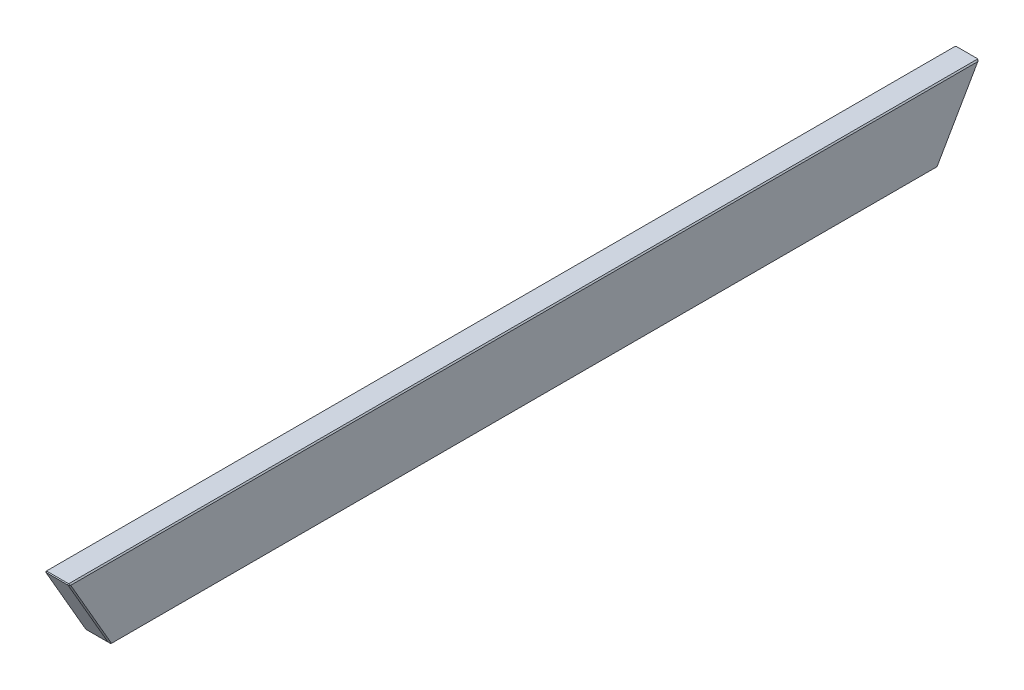
from build123d import *
from OCP.BRepFilletAPI import BRepFilletAPI_MakeChamfer

# Parameters (mm, degrees)
SKETCH1_W           = 2.1
SKETCH1_H           = 6.25
BOSS_EXTRUDE1_DEPTH = 39
DRAFT1_ANGLE        = -30
DRAFT2_ANGLE        = -30
CHAMFER1_SIZE       = 0.1
CHAMFER2_SIZE       = 0.273205081
CHAMFER2_SIZE_2     = 0.1
CHAMFER2_SIZE_3     = 0.073205081
CHAMFER2_SIZE_4     = 0.077581461
CHAMFER2_SIZE_5     = 0.171862365


with BuildPart() as part:
    # Sketch1 → Boss-Extrude1 (new, symmetric)
    with BuildSketch(Plane.XY):
        Rectangle(SKETCH1_W, SKETCH1_H)
    extrude(amount=BOSS_EXTRUDE1_DEPTH, both=True)

    # Draft1
    draft1_faces = [part.faces().sort_by_distance(p)[0] for p in [
        (0, 0, 39),
    ]]
    draft(draft1_faces, Plane(origin=(-1.05, 3.125, 39), x_dir=(0, 0, 1), z_dir=(0, 1, 0)), DRAFT1_ANGLE)

    # Draft2
    draft2_faces = [part.faces().sort_by_distance(p)[0] for p in [
        (0, 0, -39),
    ]]
    draft(draft2_faces, Plane(origin=(-1.05, 3.125, 39), x_dir=(0, 0, 1), z_dir=(0, 1, 0)), DRAFT2_ANGLE)

    # Chamfer1
    chamfer1_edges = [part.edges().sort_by_distance(p)[0] for p in [
        (1.05, -3.125, 0),
        (-1.05, -3.125, 0),
        (-1.05, 3.125, 0),
        (1.05, 3.125, 0),
    ]]
    chamfer(chamfer1_edges, length=CHAMFER1_SIZE)

    # Chamfer2
    chamfer2_edges_1 = [part.edges().sort_by_distance(p)[0] for p in [
        (0, -3.125, -35.391560818),
    ]]
    chamfer2_side_1 = [part.faces().sort_by_distance(p)[0] for p in [
        (0, -3.125, -35.389560818),
    ]]
    chamfer2_edges_2 = [part.edges().sort_by_distance(p)[0] for p in [
        (0, -3.125, 35.391560818),
    ]]
    chamfer2_side_2 = [part.faces().sort_by_distance(p)[0] for p in [
        (0, -3.125, 35.389560818),
    ]]
    chamfer2_edges_3 = [part.edges().sort_by_distance(p)[0] for p in [
        (0, 3.125, -39),
    ]]
    chamfer2_side_3 = [part.faces().sort_by_distance(p)[0] for p in [
        (0, 3.123732051, -38.999267949),
    ]]
    chamfer2_edges_4 = [part.edges().sort_by_distance(p)[0] for p in [
        (1, 3.075, -38.971132487),
    ]]
    chamfer2_side_4 = [part.faces().sort_by_distance(p)[0] for p in [
        (0.998827079, 3.074120309, -38.970624597),
    ]]
    chamfer2_edges_5 = [part.edges().sort_by_distance(p)[0] for p in [
        (1, 3.075, 38.971132487),
    ]]
    chamfer2_side_5 = [part.faces().sort_by_distance(p)[0] for p in [
        (0.998827079, 3.074120309, 38.970624597),
    ]]
    chamfer2_edges_6 = [part.edges().sort_by_distance(p)[0] for p in [
        (-1, 3.075, -38.971132487),
    ]]
    chamfer2_side_6 = [part.faces().sort_by_distance(p)[0] for p in [
        (-0.998827079, 3.074120309, -38.970624597),
    ]]
    chamfer2_edges_7 = [part.edges().sort_by_distance(p)[0] for p in [
        (-1, 3.075, 38.971132487),
    ]]
    chamfer2_side_7 = [part.faces().sort_by_distance(p)[0] for p in [
        (-0.998827079, 3.074120309, 38.970624597),
    ]]
    chamfer2_edges_8 = [part.edges().sort_by_distance(p)[0] for p in [
        (0, 3.125, 39),
    ]]
    chamfer2_side_8 = [part.faces().sort_by_distance(p)[0] for p in [
        (0, 3.123732051, 38.999267949),
    ]]
    chamfer2 = BRepFilletAPI_MakeChamfer(part.part.solid().wrapped)
    for e in chamfer2_edges_1:
        chamfer2.Add(CHAMFER2_SIZE, CHAMFER2_SIZE_2, e.wrapped, chamfer2_side_1[0].wrapped)
    for e in chamfer2_edges_2:
        chamfer2.Add(CHAMFER2_SIZE_2, CHAMFER2_SIZE, e.wrapped, chamfer2_side_2[0].wrapped)
    for e in chamfer2_edges_3:
        chamfer2.Add(CHAMFER2_SIZE_2, CHAMFER2_SIZE_3, e.wrapped, chamfer2_side_3[0].wrapped)
    for e in chamfer2_edges_4:
        chamfer2.Add(CHAMFER2_SIZE_4, CHAMFER2_SIZE_2, e.wrapped, chamfer2_side_4[0].wrapped)
    for e in chamfer2_edges_5:
        chamfer2.Add(CHAMFER2_SIZE_4, CHAMFER2_SIZE_2, e.wrapped, chamfer2_side_5[0].wrapped)
    for e in chamfer2_edges_6:
        chamfer2.Add(CHAMFER2_SIZE_4, CHAMFER2_SIZE_2, e.wrapped, chamfer2_side_6[0].wrapped)
    for e in chamfer2_edges_7:
        chamfer2.Add(CHAMFER2_SIZE_4, CHAMFER2_SIZE_2, e.wrapped, chamfer2_side_7[0].wrapped)
    for e in chamfer2_edges_8:
        chamfer2.Add(CHAMFER2_SIZE_3, CHAMFER2_SIZE_2, e.wrapped, chamfer2_side_8[0].wrapped)
    add(Compound.cast(chamfer2.Shape()), mode=Mode.REPLACE)
    chamfer2_2_edges_1 = [part.edges().sort_by_distance(p)[0] for p in [
        (1.04330127, -3.03169873, -35.445428331),
    ]]
    chamfer2_2_side_1 = [part.faces().sort_by_distance(p)[0] for p in [
        (1.043835793, -3.031164207, -35.443576691),
    ]]
    chamfer2_2_edges_2 = [part.edges().sort_by_distance(p)[0] for p in [
        (-1.04330127, -3.03169873, -35.445428331),
    ]]
    chamfer2_2_side_2 = [part.faces().sort_by_distance(p)[0] for p in [
        (-1.043835793, -3.031164207, -35.443576691),
    ]]
    chamfer2_2 = BRepFilletAPI_MakeChamfer(part.part.solid().wrapped)
    for e in chamfer2_2_edges_1:
        chamfer2_2.Add(CHAMFER2_SIZE_2, CHAMFER2_SIZE_5, e.wrapped, chamfer2_2_side_1[0].wrapped)
    for e in chamfer2_2_edges_2:
        chamfer2_2.Add(CHAMFER2_SIZE_2, CHAMFER2_SIZE_5, e.wrapped, chamfer2_2_side_2[0].wrapped)
    add(Compound.cast(chamfer2_2.Shape()), mode=Mode.REPLACE)
    chamfer2_3_edges = [part.edges().sort_by_distance(p)[0] for p in [
        (1.05, 0.062360956, -37.231784524),
        (-1.05, 0.062360956, -37.231784524),
        (-1.05, 0.016985957, 37.205587256),
        (1.05, 0.016985957, 37.205587256),
    ]]
    chamfer(chamfer2_3_edges, length=CHAMFER2_SIZE_2)


solid = part.part
